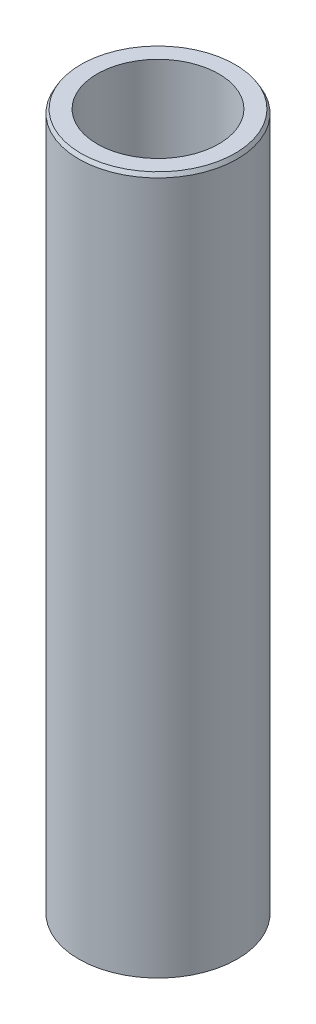
from build123d import *
from OCP.BRepFilletAPI import BRepFilletAPI_MakeChamfer

# Parameters (mm, degrees)
SKETCH1_R           = 55
BOSS_EXTRUDE1_DEPTH = 485.055794612
SKETCH2_R           = 42.182178423
CUT_EXTRUDE1_DEPTH  = 492.252607003
CHAMFER1_SIZE       = 2.628958047
CHAMFER1_SIZE2      = 1.517829636


with BuildPart() as part:
    # Sketch1 → Boss-Extrude1 (new body)
    with BuildSketch(Plane(origin=(0, 0, 0), x_dir=(1, 0, 0), z_dir=(0, 1, 0))):
        Circle(SKETCH1_R)
    extrude(amount=BOSS_EXTRUDE1_DEPTH)

    # Sketch2 → Cut-Extrude1 (cut, through all)
    with BuildSketch(Plane(origin=(0, 0, 0), x_dir=(1, 0, 0), z_dir=(0, 1, 0))):
        Circle(SKETCH2_R)
    extrude(amount=CUT_EXTRUDE1_DEPTH, mode=Mode.SUBTRACT)

    # Chamfer1: one chamfer whose edges measure the first distance from different faces: ONE call of the kernel's chamfer builder (chamfer() names one face for all edges)
    chamfer1_edges_1 = [part.edges().sort_by_distance(p)[0] for p in [
        (-55, 485.055794612, 0),
    ]]
    chamfer1_side_1 = [part.faces().sort_by_distance(p)[0] for p in [
        (-55, 242.527897306, 0),
    ]]
    chamfer1_edges_2 = [part.edges().sort_by_distance(p)[0] for p in [
        (-55, 0, 0),
    ]]
    chamfer1_side_2 = [part.faces().sort_by_distance(p)[0] for p in [
        (-53.444365081, 0, 0),
    ]]
    chamfer1 = BRepFilletAPI_MakeChamfer(part.part.solid().wrapped)
    for e in chamfer1_edges_1:
        chamfer1.Add(CHAMFER1_SIZE, CHAMFER1_SIZE2, e.wrapped, chamfer1_side_1[0].wrapped)  # the first distance lies on this face
    for e in chamfer1_edges_2:
        chamfer1.Add(CHAMFER1_SIZE, CHAMFER1_SIZE2, e.wrapped, chamfer1_side_2[0].wrapped)  # the first distance lies on this face
    add(Compound.cast(chamfer1.Shape()), mode=Mode.REPLACE)


solid = part.part
